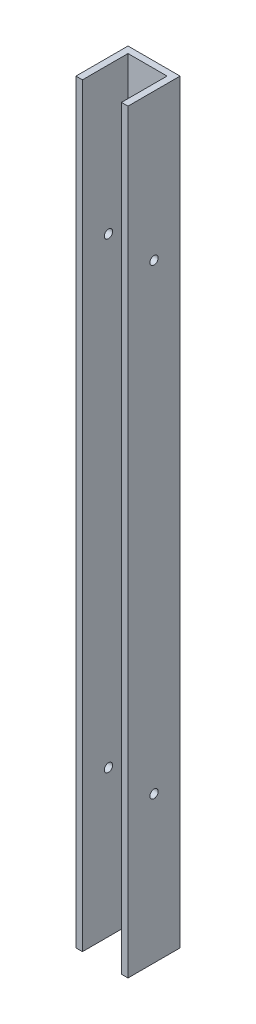
from build123d import *

# Parameters (mm, degrees)
BOSS_EXTRUDE1_DEPTH = 368.3
SKETCH2_R           = 2.032
CUT_EXTRUDE1_DEPTH  = 25.4


with BuildPart() as part:
    # Sketch1 → Boss-Extrude1 (new body)
    with BuildSketch(Plane(origin=(0, 0, 0), x_dir=(1, 0, 0), z_dir=(0, 1, 0))):
        Polygon((0, 0), (3.175, 0), (3.175, 22.225), (22.225, 22.225), (22.225, 0), (25.4, 0), (25.4, 25.4), (0, 25.4), align=None)
    extrude(amount=BOSS_EXTRUDE1_DEPTH)

    # Sketch2 → Cut-Extrude1 (cut)
    with BuildSketch(Plane.ZY):
        with Locations((-12.7, 71.4375)):
            Circle(SKETCH2_R)
        with Locations((-12.7, 296.8625)):
            Circle(SKETCH2_R)
    extrude(amount=-CUT_EXTRUDE1_DEPTH, mode=Mode.SUBTRACT)


solid = part.part
